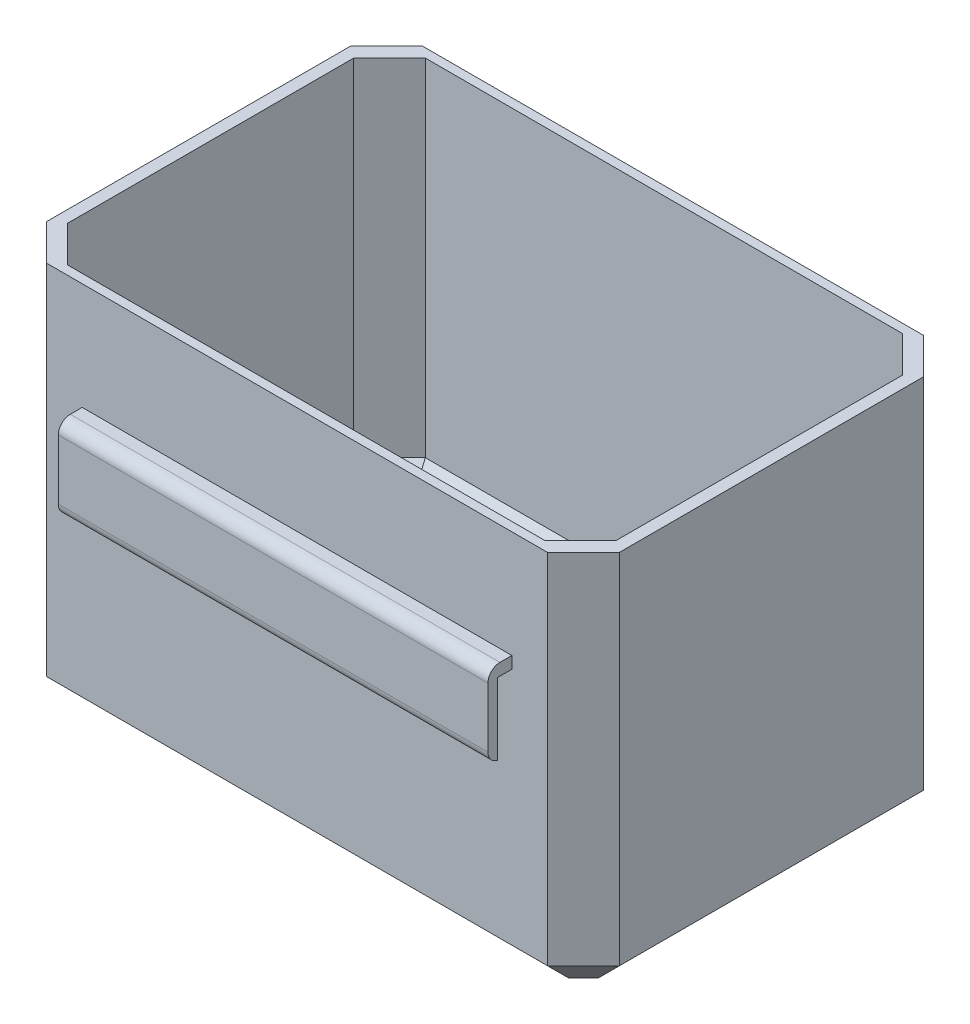
from build123d import *

# Parameters (mm, degrees)
SKETCH1_W           = 480
SKETCH1_H           = 315
BOSS_EXTRUDE1_DEPTH = 330
SKETCH9_W           = 460
SKETCH9_H           = 300
CUT_EXTRUDE1_DEPTH  = 320
CHAMFER1_SIZE       = 30
CHAMFER2_SIZE       = 30
SKETCH11_W          = 360
SKETCH11_H          = 10
BOSS_EXTRUDE2_DEPTH = 20
SKETCH12_W          = 360
SKETCH12_H          = 8
BOSS_EXTRUDE3_DEPTH = 60
FILLET1_R           = 10


with BuildPart() as part:
    # Sketch1 → Boss-Extrude1 (new body)
    with BuildSketch(Plane(origin=(0, 0, 0), x_dir=(1, 0, 0), z_dir=(0, 1, 0))):
        Rectangle(SKETCH1_W, SKETCH1_H)
    extrude(amount=BOSS_EXTRUDE1_DEPTH)

    # Sketch9 → Cut-Extrude1 (cut)
    with BuildSketch(Plane(origin=(0, 330, 0), x_dir=(1, 0, 0), z_dir=(0, 1, 0))):
        Rectangle(SKETCH9_W, SKETCH9_H)
    extrude(amount=-CUT_EXTRUDE1_DEPTH, mode=Mode.SUBTRACT)

    # Chamfer1
    chamfer1_edges = [part.edges().sort_by_distance(p)[0] for p in [
        (230, 170, -150),
        (230, 170, 150),
        (-230, 170, 150),
        (-230, 170, -150),
        (-240, 165, -157.5),
        (240, 165, -157.5),
        (240, 165, 157.5),
        (-240, 165, 157.5),
    ]]
    chamfer(chamfer1_edges, length=CHAMFER1_SIZE)

    # Chamfer2
    chamfer2_edges = [part.edges().sort_by_distance(p)[0] for p in [
        (0, 0, -157.5),
        (-240, 0, 0),
        (240, 0, 0),
        (0, 0, 157.5),
        (225, 0, 142.5),
        (-225, 0, 142.5),
        (-225, 0, -142.5),
        (225, 0, -142.5),
        (230, 10, 0),
        (0, 10, 150),
        (0, 10, -150),
        (-230, 10, 0),
        (215, 10, -135),
        (-215, 10, -135),
        (-215, 10, 135),
        (215, 10, 135),
    ]]
    chamfer(chamfer2_edges, length=CHAMFER2_SIZE)

    # Sketch11 → Boss-Extrude2 (add)
    with BuildSketch(Plane.XY.offset(157.5)):
        with Locations((0, 235.251091022)):
            Rectangle(SKETCH11_W, SKETCH11_H)
    extrude(amount=BOSS_EXTRUDE2_DEPTH)

    # Sketch12 → Boss-Extrude3 (add)
    with BuildSketch(Plane.XZ.offset(-230.251091022)):
        with Locations((0, 173.5)):
            Rectangle(SKETCH12_W, SKETCH12_H)
    extrude(amount=BOSS_EXTRUDE3_DEPTH)

    # Fillet1
    # the kernel refuses this fillet: 10 mm, written as the material it takes off along each edge
    with BuildSketch(Plane(origin=(-204.494897428, 170.251091022, 177.5), x_dir=(0, 0, -1), z_dir=(1, 0, 0))) as fillet1_piece_1:
        with BuildLine():
            CenterArc((10, 9.797958971), FILLET1_R, 180, 78.463040967)
            Line((0, 9.797958971), (-0.2, 9.797958971))
            Line((-0.2, 9.797958971), (-0.2, 0))
            Line((-0.2, 0), (0, -0.2))
            ThreePointArc((0, -0.2), (4, -0.2), (7.96, -0.195959179))
            Line((7.96, -0.195959179), (8, 0))
        make_face()
    extrude(amount=408.989794856, mode=Mode.SUBTRACT)
    with BuildSketch(Plane(origin=(205, 240.251091022, 177.5), x_dir=(0, -1, 0), z_dir=(-1, 0, 0))) as fillet1_piece_2:
        with BuildLine():
            CenterArc((FILLET1_R, -FILLET1_R), FILLET1_R, 90, 90)
            Line((0, -FILLET1_R), (-FILLET1_R * 0.02, -FILLET1_R))
            Line((-FILLET1_R * 0.02, -FILLET1_R), (-FILLET1_R * 0.02, FILLET1_R * 0.02))
            Line((-FILLET1_R * 0.02, FILLET1_R * 0.02), (FILLET1_R, FILLET1_R * 0.02))
            Line((FILLET1_R, FILLET1_R * 0.02), (FILLET1_R, 0))
        make_face()
    extrude(amount=410, mode=Mode.SUBTRACT)


solid = part.part
